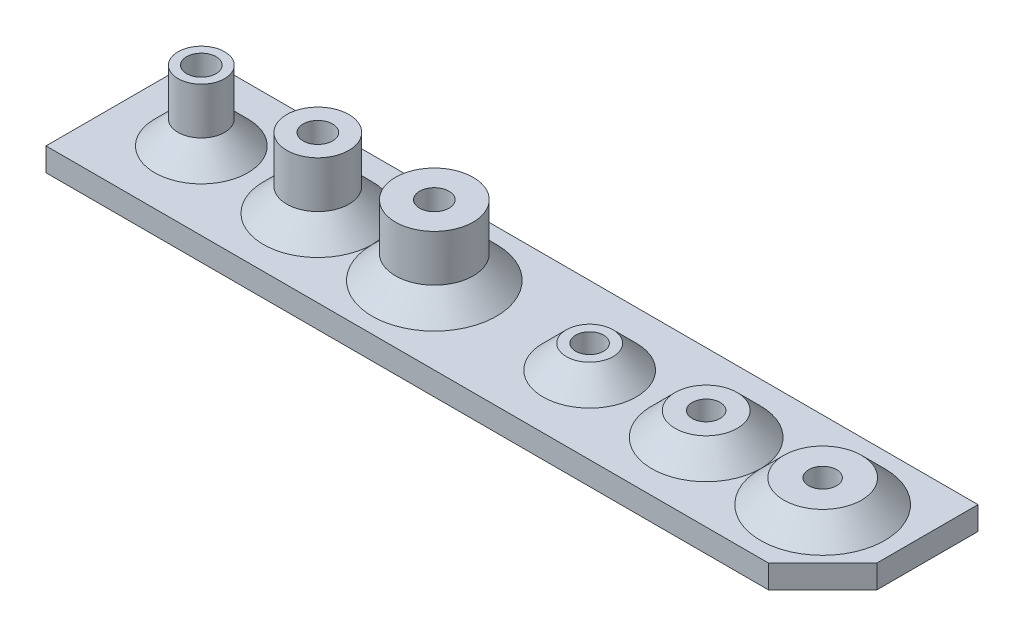
from build123d import *

# Parameters (mm, degrees)
SKETCH1_W                                         = 100
SKETCH1_H                                         = 20
BOSS_EXTRUDE1_DEPTH                               = 3
SKETCH2_R                                         = 4
SKETCH2_R_2                                       = 3
SKETCH2_R_3                                       = 5
BOSS_EXTRUDE2_DEPTH                               = 9
CHAMFER1_SIZE                                     = 3
CSK_FOR_6_FLAT_HEAD_MACHINE_SCREW_100_D           = 3.7973
CSK_FOR_6_FLAT_HEAD_MACHINE_SCREW_100_CSINK_D     = 7.0866
CSK_FOR_6_FLAT_HEAD_MACHINE_SCREW_100_CSINK_ANGLE = 100
CSK_FOR_6_FLAT_HEAD_MACHINE_SCREW_2_D             = 3.7973
CSK_FOR_6_FLAT_HEAD_MACHINE_SCREW_2_CSINK_D       = 7.0866
CSK_FOR_6_FLAT_HEAD_MACHINE_SCREW_2_CSINK_ANGLE   = 100
CSK_FOR_6_FLAT_HEAD_MACHINE_SCREW_3_D             = 3.7973
CSK_FOR_6_FLAT_HEAD_MACHINE_SCREW_3_CSINK_D       = 7.0866
CSK_FOR_6_FLAT_HEAD_MACHINE_SCREW_3_CSINK_ANGLE   = 100
CHAMFER2_SIZE                                     = 3
CHAMFER3_SIZE                                     = 3
SKETCH14_R                                        = 3
SKETCH14_R_2                                      = 4
SKETCH14_R_3                                      = 5
BOSS_EXTRUDE3_DEPTH                               = 3
CHAMFER4_SIZE                                     = 3
LPATTERN1_COUNT                                   = 3
LPATTERN1_PITCH                                   = 15
CHAMFER5_SIZE                                     = 7


with BuildPart() as part:
    # Sketch1 → Boss-Extrude1 (new body)
    with BuildSketch(Plane(origin=(0, 0, 0), x_dir=(1, 0, 0), z_dir=(0, 1, 0))):
        Rectangle(SKETCH1_W, SKETCH1_H)
    extrude(amount=BOSS_EXTRUDE1_DEPTH)

    # Sketch2 → Boss-Extrude2 (add)
    with BuildSketch(Plane(origin=(0, 3, 0), x_dir=(1, 0, 0), z_dir=(0, 1, 0))):
        with Locations(Location((-25, 0, 0), (0, 0, 90))):
            Circle(SKETCH2_R)
        with Locations(Location((-40, 0, 0), (0, 0, 90))):
            Circle(SKETCH2_R_2)
        with Locations(Location((-10, 0, 0), (0, 0, 90))):
            Circle(SKETCH2_R_3)
    extrude(amount=BOSS_EXTRUDE2_DEPTH)

    # Chamfer1
    chamfer1_edges = [part.edges().sort_by_distance(p)[0] for p in [
        (-40, 3, 3),
    ]]
    chamfer(chamfer1_edges, length=CHAMFER1_SIZE)

    # CSK for _6 Flat Head Machine Screw _100 (through all)
    with Locations(Plane(origin=(0, 0, 0), x_dir=(-1, 0, 0), z_dir=(0, -1, 0))):
        with Locations((40, 0)):
            CounterSinkHole(CSK_FOR_6_FLAT_HEAD_MACHINE_SCREW_100_D / 2, CSK_FOR_6_FLAT_HEAD_MACHINE_SCREW_100_CSINK_D / 2, counter_sink_angle=CSK_FOR_6_FLAT_HEAD_MACHINE_SCREW_100_CSINK_ANGLE)

    # CSK for _6 Flat Head Machine Screw _ 2 (through all)
    with Locations(Plane(origin=(0, 0, 0), x_dir=(-1, 0, 0), z_dir=(0, -1, 0))):
        with Locations((25, 0)):
            CounterSinkHole(CSK_FOR_6_FLAT_HEAD_MACHINE_SCREW_2_D / 2, CSK_FOR_6_FLAT_HEAD_MACHINE_SCREW_2_CSINK_D / 2, counter_sink_angle=CSK_FOR_6_FLAT_HEAD_MACHINE_SCREW_2_CSINK_ANGLE)

    # CSK for _6 Flat Head Machine Screw _ 3 (through all)
    with Locations(Plane(origin=(0, 0, 0), x_dir=(-1, 0, 0), z_dir=(0, -1, 0))):
        with Locations((10, 0)):
            CounterSinkHole(CSK_FOR_6_FLAT_HEAD_MACHINE_SCREW_3_D / 2, CSK_FOR_6_FLAT_HEAD_MACHINE_SCREW_3_CSINK_D / 2, counter_sink_angle=CSK_FOR_6_FLAT_HEAD_MACHINE_SCREW_3_CSINK_ANGLE)

    # Chamfer2
    chamfer2_edges = [part.edges().sort_by_distance(p)[0] for p in [
        (-25, 3, 4),
    ]]
    chamfer(chamfer2_edges, length=CHAMFER2_SIZE)

    # Chamfer3
    chamfer3_edges = [part.edges().sort_by_distance(p)[0] for p in [
        (-10, 3, 5),
    ]]
    chamfer(chamfer3_edges, length=CHAMFER3_SIZE - 0.0001)  # a hair under: the kernel refuses the full size

    # Sketch14 → Boss-Extrude3 (add)
    with BuildSketch(Plane(origin=(0, 3, 0), x_dir=(1, 0, 0), z_dir=(0, 1, 0))):
        with Locations(Location((10, 0, 0), (0, 0, 90))):
            Circle(SKETCH14_R)
        with Locations(Location((25, 0, 0), (0, 0, 90))):
            Circle(SKETCH14_R_2)
        with Locations(Location((40, 0, 0), (0, 0, 90))):
            Circle(SKETCH14_R_3)
    extrude(amount=BOSS_EXTRUDE3_DEPTH)

    # Chamfer4
    chamfer4_edges = [part.edges().sort_by_distance(p)[0] for p in [
        (10, 3, 3),
        (25, 3, 4),
        (40, 3, 5),
    ]]
    chamfer(chamfer4_edges, length=CHAMFER4_SIZE - 0.0001)  # a hair under: the kernel refuses the full size

    # Sketch18 → CBORE for M3 SBHCS1 (revolve, cut)
    with BuildSketch(Plane(origin=(10, 0, 0), x_dir=(0, 0, -1), z_dir=(1, 0, 0))):
        Polygon((0, 0), (0, 12), (1.8, 12), (1.8, 1.65), (3.35, 1.65), (3.35, 0.025), (3.375, 0), align=None)
    cbore_for_m3_sbhcs1 = revolve(axis=Axis((10, -6.35, 0), (0, 1, 0)), mode=Mode.SUBTRACT)

    # LPattern1: CBORE for M3 SBHCS1 ×3
    with Locations(*[(i * LPATTERN1_PITCH, 0, 0) for i in range(1, LPATTERN1_COUNT)]):
        add(cbore_for_m3_sbhcs1, mode=Mode.SUBTRACT)

    # Chamfer5
    chamfer5_edges = [part.edges().sort_by_distance(p)[0] for p in [
        (50, 1.5, 10),
    ]]
    chamfer(chamfer5_edges, length=CHAMFER5_SIZE)


solid = part.part
